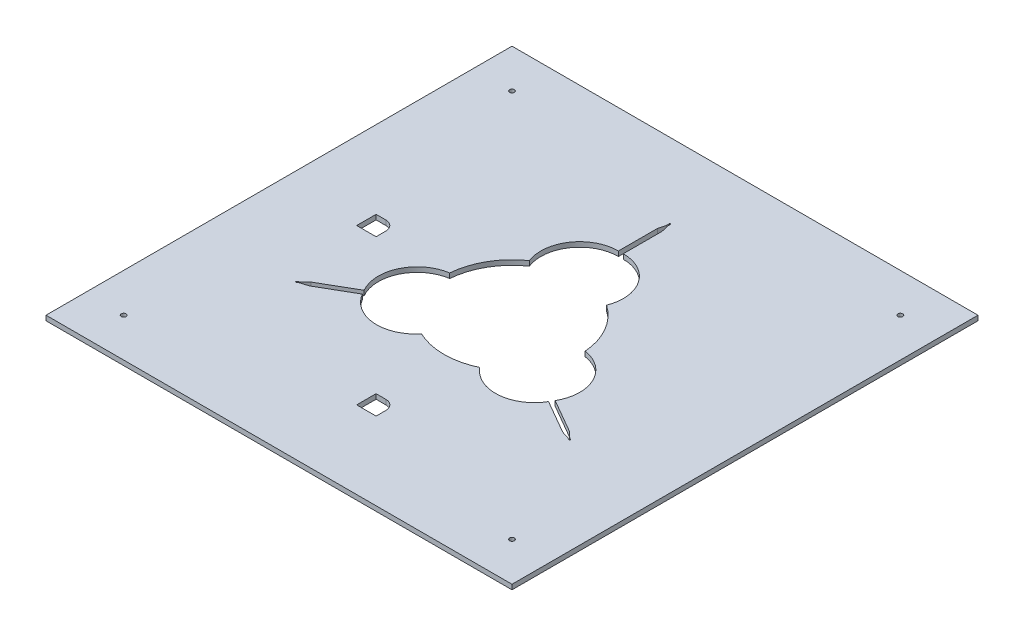
from build123d import *

# Parameters (mm, degrees)
SKETCH1_W           = 609.6
SKETCH1_H           = 609.6
BOSS_EXTRUDE1_DEPTH = 6.35
CUT_EXTRUDE2_DEPTH  = 432.099063441
SKETCH4_W           = 25.4
SKETCH4_H           = 25.4
CUT_EXTRUDE8_DEPTH  = 432.099063441
FILLET4_R           = 12.7
FILLET5_R           = 12.7
SKETCH5_R           = 3.175
CUT_EXTRUDE9_DEPTH  = 432.099063441


with BuildPart() as part:
    # Sketch1 → Boss-Extrude1 (new body)
    with BuildSketch(Plane(origin=(0, 0, 0), x_dir=(1, 0, 0), z_dir=(0, 1, 0))):
        Rectangle(SKETCH1_W, SKETCH1_H)
    extrude(amount=BOSS_EXTRUDE1_DEPTH)

    # Sketch3 → Cut-Extrude2 (cut, through all)
    with BuildSketch(Plane(origin=(0, 0, 0), x_dir=(1, 0, 0), z_dir=(0, 1, 0))):
        with BuildLine():
            Line((-3.175, 193.254689298), (-3.175, 142.454689298))
            ThreePointArc((-3.175, 142.454689298), (-45.125573361, 120.304111538), (-50.492310608, 73.169232396))
            ThreePointArc((-50.492310608, 73.169232396), (-76.989658396, 44.45), (-88.612569335, 7.143007484))
            ThreePointArc((-88.612569335, 7.143007484), (-126.749203452, -21.072162878), (-124.95687982, -68.477713992))
            Line((-124.95687982, -68.477713992), (-168.950970332, -93.877713992))
            Line((-168.950970332, -93.877713992), (-173.656481646, -98.42752932))
            Line((-173.656481646, -98.42752932), (-176.009237303, -100.702436985))
            Line((-176.009237303, -100.702436985), (-179.308794092, -102.607436985))
            ThreePointArc((-179.308794092, -102.607436985), (-179.599326756, -103.691719649), (-178.515044092, -103.982252313))
            Line((-178.515044092, -103.982252313), (-175.215487303, -102.077252313))
            Line((-175.215487303, -102.077252313), (-172.068981646, -101.177159977))
            Line((-172.068981646, -101.177159977), (-165.775970332, -99.376975306))
            Line((-165.775970332, -99.376975306), (-121.78187982, -73.976975306))
            ThreePointArc((-121.78187982, -73.976975306), (-81.623630091, -99.23194866), (-38.120258727, -80.31223988))
            ThreePointArc((-38.120258727, -80.31223988), (0, -88.9), (38.120258727, -80.31223988))
            ThreePointArc((38.120258727, -80.31223988), (81.623630091, -99.23194866), (121.78187982, -73.976975306))
            Line((121.78187982, -73.976975306), (165.775970332, -99.376975306))
            Line((165.775970332, -99.376975306), (172.068981646, -101.177159977))
            Line((172.068981646, -101.177159977), (175.215487303, -102.077252313))
            Line((175.215487303, -102.077252313), (178.515044092, -103.982252313))
            ThreePointArc((178.515044092, -103.982252313), (179.599326756, -103.691719649), (179.308794092, -102.607436985))
            Line((179.308794092, -102.607436985), (176.009237303, -100.702436985))
            Line((176.009237303, -100.702436985), (173.656481646, -98.42752932))
            Line((173.656481646, -98.42752932), (168.950970332, -93.877713992))
            Line((168.950970332, -93.877713992), (124.95687982, -68.477713992))
            ThreePointArc((124.95687982, -68.477713992), (126.749203452, -21.072162878), (88.612569335, 7.143007484))
            ThreePointArc((88.612569335, 7.143007484), (76.989658396, 44.45), (50.492310608, 73.169232396))
            ThreePointArc((50.492310608, 73.169232396), (45.125573361, 120.304111538), (3.175, 142.454689298))
            Line((3.175, 142.454689298), (3.175, 193.254689298))
            Line((3.175, 193.254689298), (1.5875, 199.604689298))
            Line((1.5875, 199.604689298), (0.79375, 202.779689298))
            Line((0.79375, 202.779689298), (0.79375, 206.589689298))
            ThreePointArc((0.79375, 206.589689298), (0, 207.383439298), (-0.79375, 206.589689298))
            Line((-0.79375, 206.589689298), (-0.79375, 202.779689298))
            Line((-0.79375, 202.779689298), (-1.5875, 199.604689298))
            Line((-1.5875, 199.604689298), (-3.175, 193.254689298))
        make_face()
    extrude(amount=CUT_EXTRUDE2_DEPTH, mode=Mode.SUBTRACT)

    # Sketch4 → Cut-Extrude8 (cut, through all)
    with BuildSketch(Plane(origin=(0, 0, 0), x_dir=(1, 0, 0), z_dir=(0, 1, 0))):
        with Locations((12.7, -190.5)):
            Rectangle(SKETCH4_W, SKETCH4_H)
        with Locations((-190.5, 12.7)):
            Rectangle(SKETCH4_W, SKETCH4_H)
    extrude(amount=CUT_EXTRUDE8_DEPTH, mode=Mode.SUBTRACT)

    # Fillet4
    fillet4_edges = [part.edges().sort_by_distance(p)[0] for p in [
        (-177.8, 3.175, -25.4),
    ]]
    fillet(fillet4_edges, radius=FILLET4_R)

    # Fillet5
    fillet5_edges = [part.edges().sort_by_distance(p)[0] for p in [
        (25.4, 3.175, 177.8),
    ]]
    fillet(fillet5_edges, radius=FILLET5_R)

    # Sketch5 → Cut-Extrude9 (cut, through all)
    with BuildSketch(Plane(origin=(0, 6.35, 0), x_dir=(1, 0, 0), z_dir=(0, 1, 0))):
        with Locations((-254, 254)):
            Circle(SKETCH5_R)
        with Locations((254, 254)):
            Circle(SKETCH5_R)
        with Locations((254, -254)):
            Circle(SKETCH5_R)
        with Locations((-254, -254)):
            Circle(SKETCH5_R)
    extrude(amount=-CUT_EXTRUDE9_DEPTH, mode=Mode.SUBTRACT)


solid = part.part
